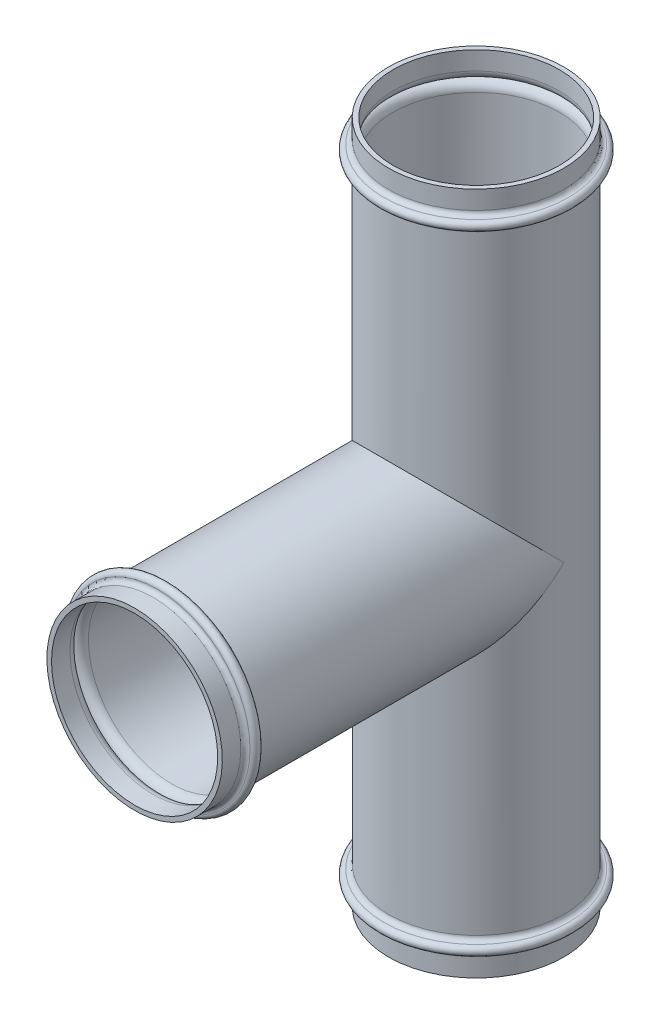
from build123d import *

# Parameters (mm, degrees)
CIRPATTERN1_COUNT = 3
CIRPATTERN1_ANGLE = 180


with BuildPart() as part:
    # Sketch1 → Revolve1 (revolve)
    with BuildSketch(Plane.XY, mode=Mode.PRIVATE) as revolve1_sk:
        with BuildLine():
            Line((-21.205998339, 13.198521386), (-11.705998339, 13.198521386))
            Line((-11.705998339, 13.198521386), (-11.705998339, 11.198521386))
            ThreePointArc((-11.705998339, 11.198521386), (-11.559551729, 10.844967995), (-11.205998339, 10.698521386))
            ThreePointArc((-11.205998339, 10.698521386), (-10.705998339, 10.198521386), (-11.205998339, 9.698521386))
            ThreePointArc((-11.205998339, 9.698521386), (-11.559551729, 9.552074776), (-11.705998339, 9.198521386))
            Line((-11.705998339, 9.198521386), (-11.705998339, -23.801478614))
            Line((-11.705998339, -23.801478614), (-21.205998339, -23.801478614))
            Line((-21.205998339, -23.801478614), (-21.205998339, 13.198521386))
        make_face()
    revolve1 = revolve(revolve1_sk.sketch.rotate(Axis((-21.205998339, -23.801478614, 0), (0, 1, 0)), 90), axis=Axis((-21.205998339, -23.801478614, 0), (0, 1, 0)))

    # CirPattern1: Revolve1 ×3 about axis
    cirpattern1_axis = Axis((0, -23.801478614, 0), (1, 0, 0))
    for i in range(1, CIRPATTERN1_COUNT):
        add(revolve1.rotate(cirpattern1_axis, i * CIRPATTERN1_ANGLE / (CIRPATTERN1_COUNT - 1)))

    # Shell1: read off the stored shape, not the designer's step
    # Shell1 outline → Shell1 (revolve, cut)
    with BuildSketch(Plane(origin=(-21.205998339, 0, 0), x_dir=(1, 0, 0), z_dir=(0, 0, 1))):
        with BuildLine():
            ThreePointArc((10, 10.198521386), (9.292893219, 10.491414605), (9, 11.198521386))
            Line((9, 11.198521386), (9, 13.198521386))
            Line((9, 13.198521386), (0, 13.198521386))
            Line((0, 13.198521386), (0, -60.801478614))
            Line((0, -60.801478614), (9, -60.801478614))
            Line((9, -60.801478614), (9, -58.801478614))
            ThreePointArc((9, -58.801478614), (9.292893219, -58.094371833), (10, -57.801478614))
            ThreePointArc((10, -57.801478614), (9.292893219, -57.508585395), (9, -56.801478614))
            Line((9, -56.801478614), (9, 9.198521386))
            ThreePointArc((9, 9.198521386), (9.292893219, 9.905628167), (10, 10.198521386))
        make_face()
    revolve(axis=Axis((-21.205998339, 0, 0), (0, 1, 0)), mode=Mode.SUBTRACT)

    # Shell1 2 outline → Shell1 2 (revolve, cut)
    with BuildSketch(Plane(origin=(-21.205998339, -23.801478614, 0), x_dir=(1, 0, 0), z_dir=(0, -1, 0))):
        with BuildLine():
            Line((9, 35), (9, 37))
            Line((9, 37), (0, 37))
            Line((0, 37), (0, 0))
            Line((0, 0), (9, 0))
            Line((9, 0), (9, 33))
            ThreePointArc((9, 33), (9.292893219, 33.707106781), (10, 34))
            ThreePointArc((10, 34), (9.292893219, 34.292893219), (9, 35))
        make_face()
    revolve(axis=Axis((-21.205998339, -23.801478614, 0), (0, 0, 1)), mode=Mode.SUBTRACT)


solid = part.part
